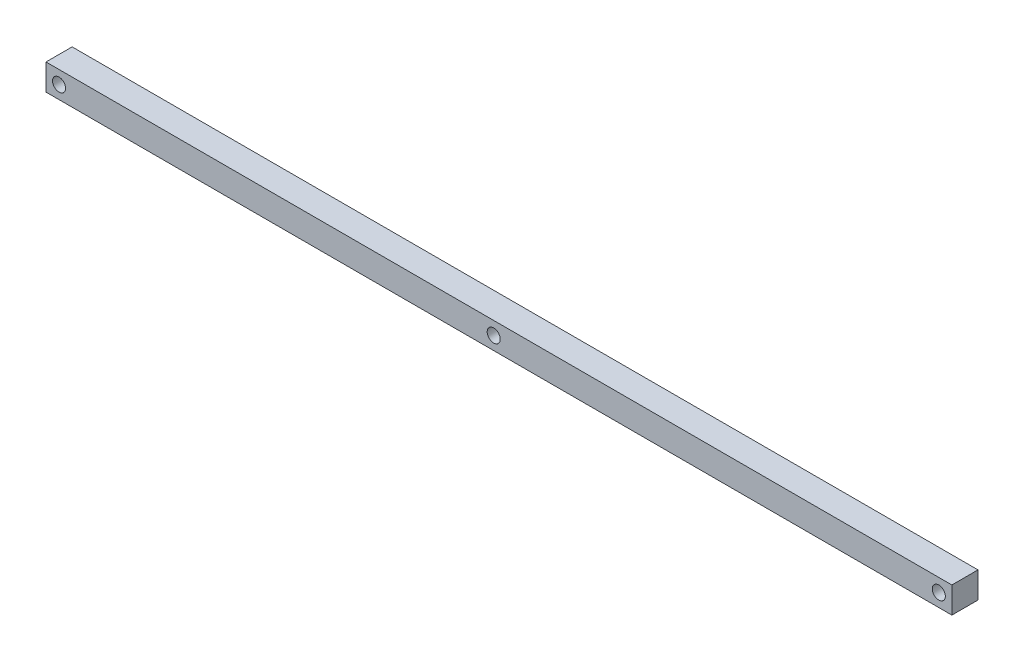
from build123d import *

# Parameters (mm, degrees)
SKETCH1_W           = 1040
SKETCH1_H           = 30
SKETCH1_R           = 7.5
BOSS_EXTRUDE1_DEPTH = 15


with BuildPart() as part:
    # Sketch1 → Boss-Extrude1 (new, symmetric)
    with BuildSketch(Plane.XY):
        Rectangle(SKETCH1_W, SKETCH1_H)
        with Locations((-505, 0)):
            Circle(SKETCH1_R, mode=Mode.SUBTRACT)
        with Locations((505, 0)):
            Circle(SKETCH1_R, mode=Mode.SUBTRACT)
        with Locations((-6, 0)):
            Circle(SKETCH1_R, mode=Mode.SUBTRACT)
    extrude(amount=BOSS_EXTRUDE1_DEPTH, both=True)


solid = part.part
